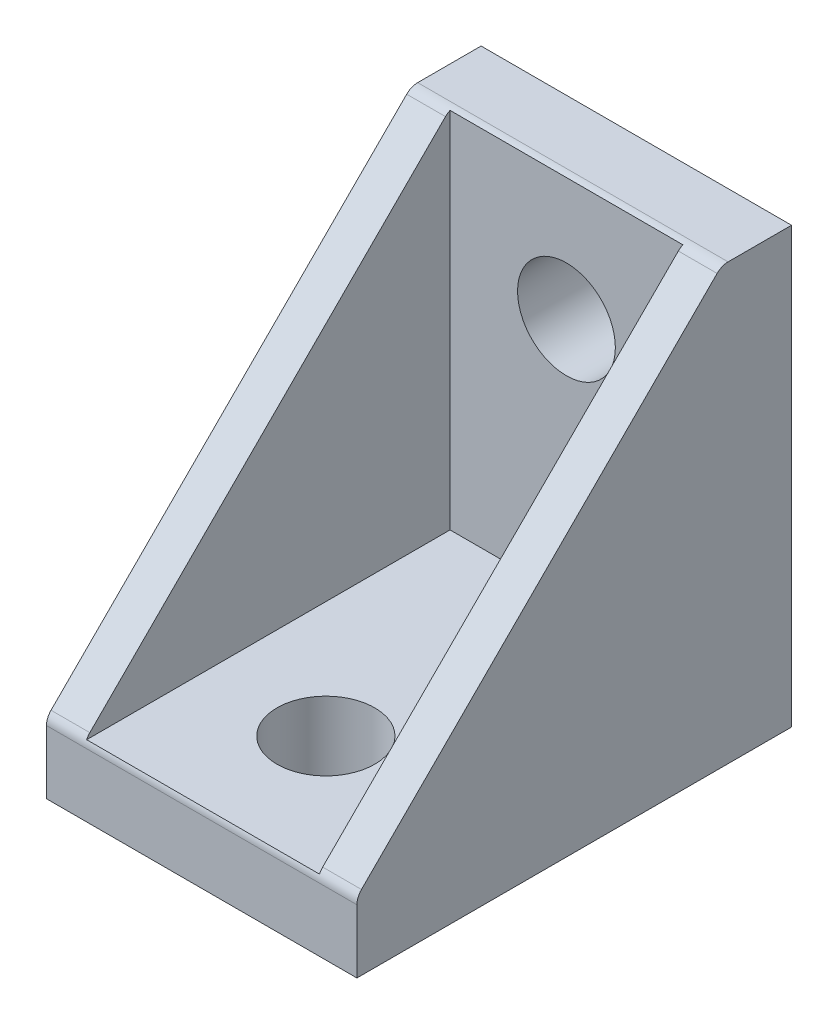
from build123d import *

# Parameters (mm, degrees)
BOSS_EXTRUDE1_DEPTH            = 20
SKETCH2_W                      = 20
SKETCH2_H                      = 23.5
BOSS_EXTRUDE2_DEPTH            = 4.5
CUT_EXTRUDE1_DEPTH             = 15
SKETCH4_W                      = 20
SKETCH4_H                      = 28
BOSS_EXTRUDE3_DEPTH            = 4.5
F_6_3_6_3_DIAMETER_HOLE1_D     = 6.3
F_6_3_6_3_DIAMETER_HOLE1_DEPTH = 28
F_6_3_6_3_DIAMETER_HOLE2_D     = 6.3
FILLET2_START                  = -11
FILLET2_DEPTH                  = 22


with BuildPart() as part:
    # Sketch1 → Boss-Extrude1 (new body)
    with BuildSketch(Plane(origin=(-10, 0, 0), x_dir=(0, -1, 0), z_dir=(-1, 0, 0))):
        with BuildLine():
            Line((-28, 4.5), (-4.5, 4.5))
            Line((-4.5, 4.5), (-4.5, 28))
            Line((-4.5, 28), (-4.792893219, 27.707106781))
            add(Edge.make_bspline(
                [(-4.792893219, 27.707106781), (-12.430964406, 20.069035594), (-20.069035594, 12.430964406), (-27.707106781, 4.792893219)],
                knots=[0, 0, 0, 0, 1, 1, 1, 1], degree=3))
            Line((-27.707106781, 4.792893219), (-28, 4.5))
        make_face()
    extrude(amount=-BOSS_EXTRUDE1_DEPTH)

    # Sketch2 → Boss-Extrude2 (add)
    with BuildSketch(Plane.XZ.offset(-4.5)):
        with Locations((0, 16.25)):
            Rectangle(SKETCH2_W, SKETCH2_H)
    extrude(amount=BOSS_EXTRUDE2_DEPTH)

    # Sketch3 → Cut-Extrude1 (cut)
    with BuildSketch(Plane(origin=(-7.5, 0, 0), x_dir=(0, -1, 0), z_dir=(-1, 0, 0))):
        with BuildLine():
            Line((-4.5, 4.5), (-4.5, 28))
            Line((-4.5, 28), (-4.792893219, 27.707106781))
            add(Edge.make_bspline(
                [(-4.792893219, 27.707106781), (-12.430964406, 20.069035594), (-20.069035594, 12.430964406), (-27.707106781, 4.792893219)],
                knots=[0, 0, 0, 0, 1, 1, 1, 1], degree=3))
            Line((-27.707106781, 4.792893219), (-28, 4.5))
            Line((-28, 4.5), (-4.5, 4.5))
        make_face()
    extrude(amount=-CUT_EXTRUDE1_DEPTH, mode=Mode.SUBTRACT)

    # Sketch4 → Boss-Extrude3 (add)
    with BuildSketch(Plane(origin=(0, 0, 4.5), x_dir=(-1, 0, 0), z_dir=(0, 0, -1))):
        with Locations((0, 14)):
            Rectangle(SKETCH4_W, SKETCH4_H)
    extrude(amount=BOSS_EXTRUDE3_DEPTH)

    # Ø6.3 (6.3) Diameter Hole1
    with Locations(Plane(origin=(0, 0, 0), x_dir=(-1, 0, 0), z_dir=(0, 0, -1))):
        with Locations((0, 20)):
            Hole(F_6_3_6_3_DIAMETER_HOLE1_D / 2, depth=F_6_3_6_3_DIAMETER_HOLE1_DEPTH)

    # Ø6.3 (6.3) Diameter Hole2 (through all)
    with Locations(Plane(origin=(0, 4.5, 0), x_dir=(1, 0, 0), z_dir=(0, 1, 0))):
        with Locations((0, -20)):
            Hole(F_6_3_6_3_DIAMETER_HOLE2_D / 2)

    # Fillet2: read off the stored shape, not the designer's step
    # Fillet2 outline → Fillet2 (cut)
    with BuildSketch(Plane.YZ.offset(FILLET2_START)):
        with BuildLine():
            Line((28, 4.085786438), (28, 4.5))
            Line((28, 4.5), (27.707106781, 4.792893219))
            ThreePointArc((27.707106781, 4.792893219), (27.923879533, 4.46846987), (28, 4.085786438))
        make_face()
        with BuildLine():
            Line((4.792893219, 27.707106781), (4.5, 28))
            Line((4.5, 28), (4.085786438, 28))
            ThreePointArc((4.085786438, 28), (4.46846987, 27.923879533), (4.792893219, 27.707106781))
        make_face()
    extrude(amount=FILLET2_DEPTH, mode=Mode.SUBTRACT)


solid = part.part
